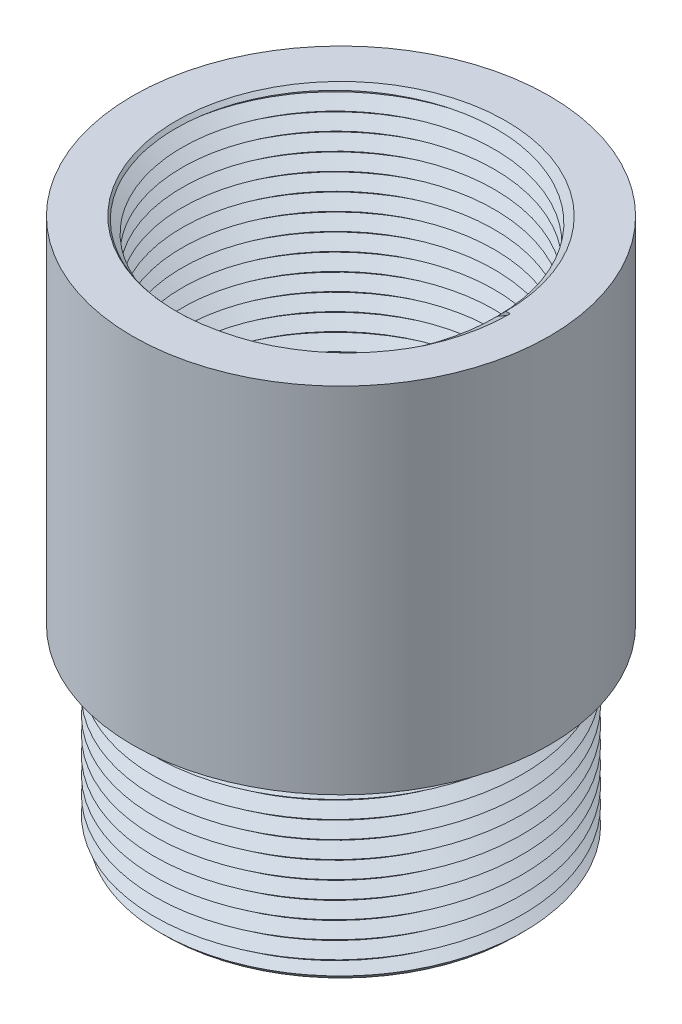
from build123d import *
from build123d.topology import SkipClean

# Parameters (mm, degrees)
BOSS_EXTRUDE1_DEPTH      = 10
BOSS_EXTRUDE1_DEPTH_BACK = 0.194542969
SKETCH1_R                = 6
SKETCH1_R_2              = 4.5
SKETCH2_R                = 5.2875
SKETCH2_R_2              = 4.5
BOSS_EXTRUDE2_DEPTH      = 0.5
SKETCH3_R                = 5.2875
SKETCH3_R_2              = 2.5
BOSS_EXTRUDE3_DEPTH      = 4.75
CHAMFER1_SIZE            = 0.25
SKETCH4_R                = 2.8
CUT_EXTRUDE1_DEPTH       = 1.2
CHAMFER2_SIZE            = 0.25
CUT_SWEEP4_PITCH         = 0.5
SKETCH13_W               = 0.717961742
SKETCH13_H               = 0.643751202
CUT_SWEEP5_PITCH         = 0.5


with BuildPart() as part:
    # Sketch1 → Boss-Extrude1 (new, two sides: drawn at the far end of the back side and taken through both)
    with BuildSketch(Plane(origin=(0, 0, 0), x_dir=(1, 0, 0), z_dir=(0, 1, 0)).offset(-BOSS_EXTRUDE1_DEPTH_BACK)):
        with Locations(Location((0, 0, 0), (0, 0, 270))):
            Circle(SKETCH1_R)
        with Locations(Location((0, 0, 0), (0, 0, 270))):
            Circle(SKETCH1_R_2, mode=Mode.SUBTRACT)
    extrude(amount=BOSS_EXTRUDE1_DEPTH + BOSS_EXTRUDE1_DEPTH_BACK)

    # Sketch2 → Boss-Extrude2 (add)
    with BuildSketch(Plane.XZ.offset(0.194542969)):
        with Locations(Location((0, 0, 0), (0, 0, 90))):
            Circle(SKETCH2_R)
        with Locations(Location((0, 0, 0), (0, 0, 90))):
            Circle(SKETCH2_R_2, mode=Mode.SUBTRACT)
    extrude(amount=BOSS_EXTRUDE2_DEPTH)

    # Sketch3 → Boss-Extrude3 (add)
    with BuildSketch(Plane.XZ.offset(0.694542969)):
        with Locations(Location((0, 0, 0), (0, 0, 90))):
            Circle(SKETCH3_R)
        with Locations(Location((0, 0, 0), (0, 0, 270))):
            Circle(SKETCH3_R_2, mode=Mode.SUBTRACT)
    extrude(amount=BOSS_EXTRUDE3_DEPTH)

    # Chamfer1
    chamfer1_edges = [part.edges().sort_by_distance(p)[0] for p in [
        (0, -5.444542969, -5.2875),
    ]]
    chamfer(chamfer1_edges, length=CHAMFER1_SIZE)

    # Sketch4 → Cut-Extrude1 (cut)
    with BuildSketch(Plane.XZ.offset(5.444542969)):
        with Locations(Location((0, 0, 0), (0, 0, 270))):
            Circle(SKETCH4_R)
    extrude(amount=-CUT_EXTRUDE1_DEPTH, mode=Mode.SUBTRACT)

    # Chamfer2
    chamfer2_edges = [part.edges().sort_by_distance(p)[0] for p in [
        (0, 10, -4.5),
    ]]
    chamfer(chamfer2_edges, length=CHAMFER2_SIZE)

    # Cut-Sweep4: the profile of Sketch12 screwed along a right-hand helix of 15 turns, 6 arcs to a turn; built about Z, then put on its axis
    cut_sweep4_z = Axis((0, 0, 0), (0, 0, 1))
    cut_sweep4_corners = [(4.5, 0, 0.25), (4.875, 0, 0.033493649), (4.875, 0, 0), (4.875, 0, -0.033493649), (4.5, 0, -0.25), (4.305346521, 0, -0.25), (4.305346521, 0, 0.25)]
    with BuildLine(mode=Mode.PRIVATE) as cut_sweep4_profile:
        Line(cut_sweep4_corners[0], cut_sweep4_corners[1])
        Line(cut_sweep4_corners[1], cut_sweep4_corners[2])
        Line(cut_sweep4_corners[2], cut_sweep4_corners[3])
        Line(cut_sweep4_corners[3], cut_sweep4_corners[4])
        Line(cut_sweep4_corners[4], cut_sweep4_corners[5])
        Line(cut_sweep4_corners[5], cut_sweep4_corners[6])
        Line(cut_sweep4_corners[6], cut_sweep4_corners[0])
    cut_sweep4_cap = Face(cut_sweep4_profile.wire())
    cut_sweep4_turn_angles = [0, 30, 60, 90, 120, 150, 180, 210, 240, 270, 300, 330, 360]
    cut_sweep4_turn_weights = [1, 0.8660254037844387, 1, 0.8660254037844387, 1, 0.8660254037844387, 1, 0.8660254037844387, 1, 0.8660254037844387, 1, 0.8660254037844387, 1]
    cut_sweep4_turn_rails = [Edge.make_bspline([Vector(p[0], p[1], 0).rotate(cut_sweep4_z, cut_sweep4_turn_angles[k]) / cut_sweep4_turn_weights[k] + Vector(0, 0, p[2] + CUT_SWEEP4_PITCH * cut_sweep4_turn_angles[k] / 360) for k in range(13)], [0, 0, 0, 1, 1, 2, 2, 3, 3, 4, 4, 5, 5, 6, 6, 6], 2, cut_sweep4_turn_weights) for p in cut_sweep4_corners]
    cut_sweep4_turn_sides = [Face.make_surface_from_curves(cut_sweep4_turn_rails[p[0]], cut_sweep4_turn_rails[p[1]]) for p in [(0, 1), (1, 2), (2, 3), (3, 4), (4, 5), (5, 6), (6, 0)]]
    cut_sweep4_turn = Solid(Shell([*cut_sweep4_turn_sides, cut_sweep4_cap, cut_sweep4_cap.rotate(cut_sweep4_z, 360).moved(Location((0, 0, CUT_SWEEP4_PITCH * 360 / 360)))]))
    cut_sweep4_each = [*[cut_sweep4_turn.moved(Location((0, 0, CUT_SWEEP4_PITCH * i))) for i in range(15)]]
    add(Plane(origin=(0, 10, 0), x_dir=(1, 0, 0), z_dir=(0, -1, 0)) * Compound([cut_sweep4_each[i] for i in range(0, 15, 2)]), mode=Mode.SUBTRACT)
    add(Plane(origin=(0, 10, 0), x_dir=(1, 0, 0), z_dir=(0, -1, 0)) * Compound([cut_sweep4_each[i] for i in range(1, 15, 2)]), mode=Mode.SUBTRACT)

    # Sketch13 → Cut-Revolve2 (revolve, cut)
    with BuildSketch(Plane.XY, mode=Mode.PRIVATE) as cut_revolve2_sk:
        with Locations((4.516019129, 2.14463075)):
            Rectangle(SKETCH13_W, SKETCH13_H)
    revolve(cut_revolve2_sk.sketch.rotate(Axis((0, -0.194542969, 0), (0, 1, 0)), 90), axis=Axis((0, -0.194542969, 0), (0, 1, 0)), mode=Mode.SUBTRACT)

    # Cut-Sweep5: the profile of Sketch15 screwed along a right-hand helix of 10 turns, 6 arcs to a turn; built about Z, then put on its axis
    with SkipClean():  # the faces are left unmerged after this step: merging them gives an invalid solid
        cut_sweep5_z = Axis((0, 0, 0), (0, 0, 1))
        cut_sweep5_corners = [(5.2875, 0, 0.194542969), (4.9125, 0, -0.021963382), (4.9125, 0, -0.055457031), (4.9125, 0, -0.08895068), (5.2875, 0, -0.305457031), (5.482153479, 0, -0.305457031), (5.482153479, 0, 0.194542969)]
        with BuildLine(mode=Mode.PRIVATE) as cut_sweep5_profile:
            Line(cut_sweep5_corners[0], cut_sweep5_corners[1])
            Line(cut_sweep5_corners[1], cut_sweep5_corners[2])
            Line(cut_sweep5_corners[2], cut_sweep5_corners[3])
            Line(cut_sweep5_corners[3], cut_sweep5_corners[4])
            Line(cut_sweep5_corners[4], cut_sweep5_corners[5])
            Line(cut_sweep5_corners[5], cut_sweep5_corners[6])
            Line(cut_sweep5_corners[6], cut_sweep5_corners[0])
        cut_sweep5_cap = Face(cut_sweep5_profile.wire())
        cut_sweep5_turn_angles = [0, 30, 60, 90, 120, 150, 180, 210, 240, 270, 300, 330, 360]
        cut_sweep5_turn_weights = [1, 0.8660254037844387, 1, 0.8660254037844387, 1, 0.8660254037844387, 1, 0.8660254037844387, 1, 0.8660254037844387, 1, 0.8660254037844387, 1]
        cut_sweep5_turn_rails = [Edge.make_bspline([Vector(p[0], p[1], 0).rotate(cut_sweep5_z, cut_sweep5_turn_angles[k]) / cut_sweep5_turn_weights[k] + Vector(0, 0, p[2] + CUT_SWEEP5_PITCH * cut_sweep5_turn_angles[k] / 360) for k in range(13)], [0, 0, 0, 1, 1, 2, 2, 3, 3, 4, 4, 5, 5, 6, 6, 6], 2, cut_sweep5_turn_weights) for p in cut_sweep5_corners]
        cut_sweep5_turn_sides = [Face.make_surface_from_curves(cut_sweep5_turn_rails[p[0]], cut_sweep5_turn_rails[p[1]]) for p in [(0, 1), (1, 2), (2, 3), (3, 4), (4, 5), (5, 6), (6, 0)]]
        cut_sweep5_turn = Solid(Shell([*cut_sweep5_turn_sides, cut_sweep5_cap, cut_sweep5_cap.rotate(cut_sweep5_z, 360).moved(Location((0, 0, CUT_SWEEP5_PITCH * 360 / 360)))]))
        cut_sweep5_each = [*[cut_sweep5_turn.moved(Location((0, 0, CUT_SWEEP5_PITCH * i))) for i in range(10)]]
        add(Plane(origin=(0, -5.444542969, 0), x_dir=(1, 0, 0), z_dir=(0, 1, 0)) * Compound([cut_sweep5_each[i] for i in range(0, 10, 2)]), mode=Mode.SUBTRACT)
        add(Plane(origin=(0, -5.444542969, 0), x_dir=(1, 0, 0), z_dir=(0, 1, 0)) * Compound([cut_sweep5_each[i] for i in range(1, 10, 2)]), mode=Mode.SUBTRACT)


solid = part.part
